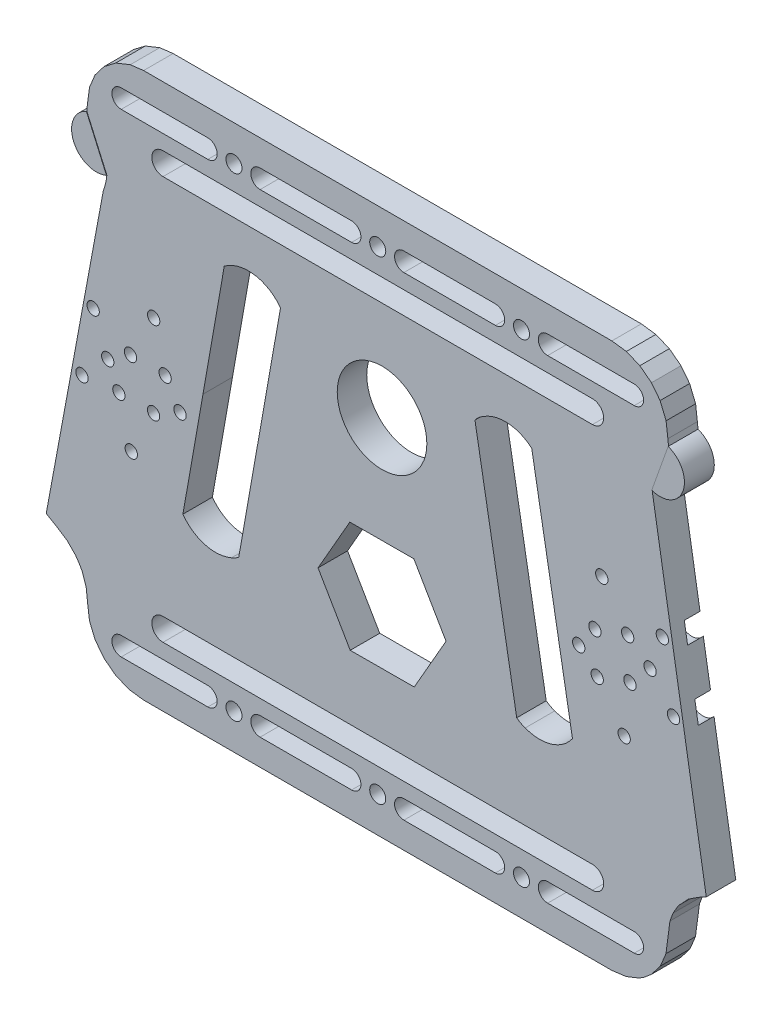
from build123d import *

# Parameters (mm, degrees)
EXTRUDE_1_DEPTH      = 7.9
SKETCH_2_R           = 1.65
CUT_EXTRUDE_1_DEPTH  = 7.9
SKETCH_3_R           = 3.8
CUT_EXTRUDE_2_DEPTH  = 4.2
SKETCH_4_R           = 2.15
CUT_EXTRUDE_4_DEPTH  = 44.2
CUT_EXTRUDE_5_DEPTH  = 44.2
SKETCH_10_R          = 1.65
CUT_EXTRUDE_6_DEPTH  = 44.2
CUT_EXTRUDE_7_DEPTH  = 10
CUT_EXTRUDE_8_DEPTH  = 10
CUT_EXTRUDE_9_DEPTH  = 10
SKETCH_14_R          = 1.65
CUT_EXTRUDE_10_DEPTH = 10
SKETCH_16_R          = 3.8
CUT_EXTRUDE_11_DEPTH = 4.2
CUT_EXTRUDE_12_DEPTH = 10
CUT_EXTRUDE_13_DEPTH = 10
FILLET_1_R           = 10
FILLET_START         = -1
FILLET_2_DEPTH       = 10
FILLET_4_R           = 2
FILLET_5_R           = 10
FILLET_7_R           = 3
CUT_EXTRUDE_15_DEPTH = 10
EXTRUDE_2_DEPTH      = 8
SKETCH_26_R          = 12
CUT_EXTRUDE_17_DEPTH = 162


with BuildPart() as part:
    # 草图1 → 凸台-拉伸1 (new body)
    with BuildSketch(Plane.XY):
        Polygon((-10.305702603, 68.606601718), (-12.692955915, 65.493979681), (-14.189528165, 61.876534179), (-14.699100885, 58), (-14.70067514, 57.601052113), (-14.77881855, 57.412167461), (-15.054381323, 54.573032239), (-16.159009324, 51.363451204), (-17.862653632, 48.604326557), (-20.254556955, 46.165014633), (-20.718749039, 45.625960936), (-20.964899937, 44.958530853), (-23.319564087, 31.429589539), (-22.957868176, 30.282436667), (-22.625738047, 29.915023731), (-22.142232012, 29.606620125), (-21.666860443, 29.459974033), (-19.523247649, 29.081997262), (-17.379634855, 28.70402049), (-16.666577501, 28.484051352), (-16.093471071, 28.144249508), (-15.936735259, 28.017485287), (-15.443123256, 27.47032654), (-15.092973508, 26.806644636), (-14.912685899, 26.018841536), (-14.900579388, 25.749597231), (-14.957245947, 25.165759219), (-26.620853412, -41.025673469), (-26.628464015, -41.199984954), (-26.547792108, -41.762283515), (-26.368057646, -42.1868051), (-26.056996513, -42.599733112), (-22.845462219, -44.475665886), (-20.18788619, -46.219365909), (-17.900579388, -48.555812521), (-16.896667913, -50.001863236), (-16.145337406, -51.392208514), (-15.074507578, -54.48350874), (-14.699100885, -58), (-14.189528165, -61.876534179), (-12.692955915, -65.493979681), (-10.305702603, -68.606601718), (-7.193080565, -70.99385503), (-3.575635064, -72.49042728), (0.300899115, -73), (125.699100885, -73), (129.575635064, -72.49042728), (132.886301512, -71.16602245), (133.848368307, -70.593229947), (134.30843717, -70.283294701), (136.305702603, -68.606601718), (138.692955915, -65.493979681), (140.189528165, -61.876534179), (140.699100885, -58), (141.254605616, -53.774041673), (142.087560808, -51.515511001), (143.523015152, -49.058061077), (146.18788619, -46.219365909), (148.845462219, -44.475665886), (150.900129557, -43.358777059), (151.654650016, -42.916650994), (152.056996513, -42.599733112), (152.350719669, -42.216761952), (152.44744501, -42.031434376), (152.551722788, -41.748688604), (152.623435941, -41.341713631), (152.628464015, -41.199984954), (152.598079521, -40.852688599), (140.946156129, 25.228652698), (140.900579388, 25.749597231), (140.97479102, 26.412743086), (141.213193945, 27.0829987), (141.602446059, 27.67796006), (142.087560808, 28.1397779), (142.663370866, 28.482602001), (143.346454142, 28.69797733), (147.715814351, 29.469236069), (148.142232012, 29.606620125), (148.507788071, 29.820824869), (148.769890787, 30.052435784), (148.957868176, 30.282436667), (149.050507066, 30.427673174), (149.235552102, 30.856013103), (149.316204873, 31.313720762), (149.297310528, 31.727110992), (146.772117825, 45.529310251), (144.408906028, 48.203641159), (143.944943592, 48.499578911), (142.159009324, 51.363451204), (141.067461329, 54.51456119), (140.699100885, 57.818365652), (140.226674821, 61.734915731), (138.61919198, 65.620449206), (136.305702603, 68.606601718), (133.193080565, 70.99385503), (129.575635064, 72.49042728), (125.699100885, 73), (0.300899115, 73), (-3.265894684, 72.569762592), (-7.165299034, 71.009838016), align=None)
    extrude(amount=EXTRUDE_1_DEPTH)

    # 草图2 → 切除-拉伸1 (cut)
    with BuildSketch(Plane.XY):
        with Locations((-13.214266644, 11.088086267)):
            Circle(SKETCH_2_R)
        with Locations((2.995431065, 16.987933739)):
            Circle(SKETCH_2_R)
        with Locations((-16.209697709, -5.899847472)):
            Circle(SKETCH_2_R)
        with Locations((-2.995431065, -16.987933739)):
            Circle(SKETCH_2_R)
        with Locations((123.004568935, 16.987933739)):
            Circle(SKETCH_2_R)
        with Locations((139.214266644, 11.088086267)):
            Circle(SKETCH_2_R)
        with Locations((142.209697709, -5.899847472)):
            Circle(SKETCH_2_R)
        with Locations((128.995431065, -16.987933739)):
            Circle(SKETCH_2_R)
    extrude(amount=CUT_EXTRUDE_1_DEPTH, mode=Mode.SUBTRACT)

    # 草图3 → 切除-拉伸2 (cut)
    with BuildSketch(Plane.XY):
        with Locations((-13.214266644, 11.088086267)):
            Circle(SKETCH_3_R)
        with Locations((2.995431065, 16.987933739)):
            Circle(SKETCH_3_R)
        with Locations((-16.209697709, -5.899847472)):
            Circle(SKETCH_3_R)
        with Locations((-2.995431065, -16.987933739)):
            Circle(SKETCH_3_R)
        with Locations((123.004568935, 16.987933739)):
            Circle(SKETCH_3_R)
        with Locations((139.214266644, 11.088086267)):
            Circle(SKETCH_3_R)
        with Locations((142.209697709, -5.899847472)):
            Circle(SKETCH_3_R)
        with Locations((128.995431065, -16.987933739)):
            Circle(SKETCH_3_R)
    extrude(amount=CUT_EXTRUDE_2_DEPTH, mode=Mode.SUBTRACT)

    # 草图4 → 切除-拉伸4 (cut)
    with BuildSketch(Plane.XY):
        with Locations((24.5, 63.5)):
            Circle(SKETCH_4_R)
        with Locations((63, 63.5)):
            Circle(SKETCH_4_R)
        with Locations((101.5, 63.5)):
            Circle(SKETCH_4_R)
        with Locations((24.5, -63.5)):
            Circle(SKETCH_4_R)
        with Locations((63, -63.5)):
            Circle(SKETCH_4_R)
        with Locations((101.5, -63.5)):
            Circle(SKETCH_4_R)
        with BuildLine():
            Line((-5.699100885, 66), (17.5, 66))
            ThreePointArc((17.5, 66), (20, 63.5), (17.5, 61))
            Line((17.5, 61), (-5.699100885, 61))
            ThreePointArc((-5.699100885, 61), (-8.199100885, 63.5), (-5.699100885, 66))
        make_face()
        with BuildLine():
            Line((31.5, 66), (56, 66))
            ThreePointArc((56, 66), (58.5, 63.5), (56, 61))
            Line((56, 61), (31.5, 61))
            ThreePointArc((31.5, 61), (29, 63.5), (31.5, 66))
        make_face()
        with BuildLine():
            Line((-5.699100885, -61), (17.5, -61))
            ThreePointArc((17.5, -61), (20, -63.5), (17.5, -66))
            Line((17.5, -66), (-5.699100885, -66))
            ThreePointArc((-5.699100885, -66), (-8.199100885, -63.5), (-5.699100885, -61))
        make_face()
        with BuildLine():
            Line((31.5, -61), (56, -61))
            ThreePointArc((56, -61), (58.5, -63.5), (56, -66))
            Line((56, -66), (31.5, -66))
            ThreePointArc((31.5, -66), (29, -63.5), (31.5, -61))
        make_face()
        with BuildLine():
            Line((70, -66), (94.5, -66))
            ThreePointArc((94.5, -66), (97, -63.5), (94.5, -61))
            Line((94.5, -61), (70, -61))
            ThreePointArc((70, -61), (67.5, -63.5), (70, -66))
        make_face()
        with BuildLine():
            Line((108.5, -61), (131.699100885, -61))
            ThreePointArc((131.699100885, -61), (134.199100885, -63.5), (131.699100885, -66))
            Line((131.699100885, -66), (108.5, -66))
            ThreePointArc((108.5, -66), (106, -63.5), (108.5, -61))
        make_face()
        with BuildLine():
            Line((5.5, -51), (120.5, -51))
            ThreePointArc((120.5, -51), (123.5, -54), (120.5, -57))
            Line((120.5, -57), (5.5, -57))
            ThreePointArc((5.5, -57), (2.5, -54), (5.5, -51))
        make_face()
        with BuildLine():
            Line((5.5, 57), (120.5, 57))
            ThreePointArc((120.5, 57), (123.5, 54), (120.5, 51))
            Line((120.5, 51), (5.5, 51))
            ThreePointArc((5.5, 51), (2.5, 54), (5.5, 57))
        make_face()
        with BuildLine():
            Line((70, 66), (94.5, 66))
            ThreePointArc((94.5, 66), (97, 63.5), (94.5, 61))
            Line((94.5, 61), (70, 61))
            ThreePointArc((70, 61), (67.5, 63.5), (70, 66))
        make_face()
        with BuildLine():
            Line((108.5, 61), (131.699100885, 61))
            ThreePointArc((131.699100885, 61), (134.199100885, 63.5), (131.699100885, 66))
            Line((131.699100885, 66), (108.5, 66))
            ThreePointArc((108.5, 66), (106, 63.5), (108.5, 61))
        make_face()
    extrude(amount=CUT_EXTRUDE_4_DEPTH, mode=Mode.SUBTRACT)

    # 草图5 → 切除-拉伸5 (cut)
    with BuildSketch(Plane.XY):
        with BuildLine():
            Line((99.95897033, 37.693501904), (111.099420612, -25.749597231))
            ThreePointArc((111.099420612, -25.749597231), (105.951227077, -28.702394871), (100.222961283, -27.150015547))
            Line((100.222961283, -27.150015547), (92.395572602, 17.241186617))
            Line((92.395572602, 17.241186617), (89.033748577, 36.306984423))
            ThreePointArc((89.033748577, 36.306984423), (94.209202281, 39.262930674), (99.95897033, 37.693501904))
        make_face()
        with BuildLine():
            Line((26.04102967, 37.693501904), (14.900579388, -25.749597231))
            ThreePointArc((14.900579388, -25.749597231), (20.052100679, -28.697193196), (25.779041413, -27.138782652))
            Line((25.779041413, -27.138782652), (33.604427398, 17.241186617))
            Line((33.604427398, 17.241186617), (36.96624196, 36.306984423))
            ThreePointArc((36.96624196, 36.306984423), (31.790792987, 39.262928715), (26.04102967, 37.693501904))
        make_face()
    extrude(amount=CUT_EXTRUDE_5_DEPTH, mode=Mode.SUBTRACT)

    # 草图10 → 切除-拉伸6 (cut)
    with BuildSketch(Plane.XY.offset(7.9)):
        with Locations((-6.317784188, -4.999790859)):
            Circle(SKETCH_10_R)
        with Locations((2.971169873, -5.134977431)):
            Circle(SKETCH_10_R)
        with Locations((-3.210982995, 5.315366562)):
            Circle(SKETCH_10_R)
        with Locations((6.0633334, 5.159308491)):
            Circle(SKETCH_10_R)
        with Locations((121.773254005, -6.859076029)):
            Circle(SKETCH_10_R)
        with Locations((130.548252121, -3.809100454)):
            Circle(SKETCH_10_R)
        with Locations((121.164700541, 3.896589871)):
            Circle(SKETCH_10_R)
        with Locations((129.933082223, 6.921946276)):
            Circle(SKETCH_10_R)
    extrude(amount=-CUT_EXTRUDE_6_DEPTH, mode=Mode.SUBTRACT)

    # 草图11 → 切除-拉伸7 (cut)
    with BuildSketch(Plane(origin=(0, 0, 0), x_dir=(-1, 0, 0), z_dir=(0, 0, -1))):
        Polygon((-16.209697709, 5.899847472), (-13.214266644, -11.088086267), (-10.828105678, -24.62067757), (-14.971068735, -25.34817157), (-26.04102967, 37.693501904), (-21.898066613, 38.420995904), align=None)
    extrude(amount=-CUT_EXTRUDE_7_DEPTH, mode=Mode.SUBTRACT)

    # 草图12 → 切除-拉伸8 (cut)
    with BuildSketch(Plane(origin=(0, 0, 0), x_dir=(-1, 0, 0), z_dir=(0, 0, -1))):
        with BuildLine():
            Line((-25.779041413, -27.138782652), (-10.828105678, -24.62067757))
            ThreePointArc((-10.828105678, -24.62067757), (-17.782056907, -28.976170287), (-25.779041413, -27.138782652))
        make_face()
    extrude(amount=-CUT_EXTRUDE_8_DEPTH, mode=Mode.SUBTRACT)

    # 草图13 → 切除-拉伸9 (cut)
    with BuildSketch(Plane(origin=(0, 0, 0), x_dir=(-1, 0, 0), z_dir=(0, 0, -1))):
        with BuildLine():
            Line((-36.96624196, 36.306984423), (-28.974929156, 35.896086524))
            Line((-28.974929156, 35.896086524), (-21.898066613, 38.420995904))
            ThreePointArc((-21.898066613, 38.420995904), (-29.8699804, 40.484711458), (-36.96624196, 36.306984423))
        make_face()
    extrude(amount=-CUT_EXTRUDE_9_DEPTH, mode=Mode.SUBTRACT)

    # 草图14 → 切除-拉伸10 (cut)
    with BuildSketch(Plane(origin=(0, 0, 0), x_dir=(-1, 0, 0), z_dir=(0, 0, -1))):
        with Locations((-135.924131181, 2.119648316)):
            Circle(SKETCH_14_R)
        with Locations((-116.825832972, -1.988783195)):
            Circle(SKETCH_14_R)
        with Locations((-10.050595259, -1.402434888)):
            Circle(SKETCH_14_R)
        with Locations((9.301100971, 1.268905029)):
            Circle(SKETCH_14_R)
    extrude(amount=-CUT_EXTRUDE_10_DEPTH, mode=Mode.SUBTRACT)

    # 草图16 → 切除-拉伸11 (cut)
    with BuildSketch(Plane(origin=(0, 0, 0), x_dir=(-1, 0, 0), z_dir=(0, 0, -1))):
        with Locations((-10.050595259, -1.402434888)):
            Circle(SKETCH_16_R)
        with Locations((9.301100971, 1.268905029)):
            Circle(SKETCH_16_R)
        with Locations((-135.924131181, 2.119648316)):
            Circle(SKETCH_16_R)
        with Locations((-116.825832972, -1.988783195)):
            Circle(SKETCH_16_R)
    extrude(amount=-CUT_EXTRUDE_11_DEPTH, mode=Mode.SUBTRACT)

    # 草图19 → 切除-拉伸12 (cut)
    with BuildSketch(Plane(origin=(0, 0, 0), x_dir=(-1, 0, 0), z_dir=(0, 0, -1))):
        with BuildLine():
            Line((-115.153671104, -24.517328565), (-104.239534494, 37.379815966))
            ThreePointArc((-104.239534494, 37.379815966), (-96.414450848, 39.992621571), (-89.033748577, 36.306984423))
            Line((-89.033748577, 36.306984423), (-100.222961283, -27.150015547))
            ThreePointArc((-100.222961283, -27.150015547), (-108.23356352, -28.925923308), (-115.153671104, -24.517328565))
        make_face()
    extrude(amount=-CUT_EXTRUDE_12_DEPTH, mode=Mode.SUBTRACT)

    # 草图21 → 切除-拉伸13 (cut)
    with BuildSketch(Plane(origin=(0, 0, 0), x_dir=(-1, 0, 0), z_dir=(0, 0, -1))):
        Polygon((-146.772117825, 45.529310251), (-136.474652846, 43.814333368), (-152.089030449, -49.941161633), (-165.706167888, -46.67255076), (-171.282973385, -2.85479329), (-169.291257136, 53.311604922), align=None)
        Polygon((20.964899937, 44.958530853), (10.314171456, 43.814333368), (9.539410351, 43.814333368), (10.543371006, 39.469394477), (28.555174708, -57.759288962), (35.414771485, -56.488535248), (38.378386576, 38.899500191), align=None)
    extrude(amount=-CUT_EXTRUDE_13_DEPTH, mode=Mode.SUBTRACT)

    # 圆角1
    # the kernel refuses this fillet: 10 mm, written as the material it takes off along each edge
    with BuildSketch(Plane(origin=(146.772117825, 45.529310251, -22.647011677), x_dir=(-0.9864136024690109, -0.1642808718752981, 0), z_dir=(0, 0, 1))) as fillet_1_piece_1:
        with BuildLine():
            CenterArc((9.058804671, -10), FILLET_1_R, 90, 45.783037724)
            Line((1.891762849, -3.026226881), (0, 0))
            Line((0, 0), (9.058804671, 0))
        make_face()
    extrude(amount=53.194023354, mode=Mode.SUBTRACT)

    # 圆角2: read off the stored shape, not the designer's step
    # 圆角2 outline → 圆角2 (cut)
    with BuildSketch(Plane.XY.offset(FILLET_START)):
        with BuildLine():
            ThreePointArc((143.944943592, 48.499578911), (143.235107621, 47.001088149), (142.074248426, 45.817133928))
            ThreePointArc((142.074248426, 45.817133928), (143.341874852, 46.912269), (144.408906028, 48.203641159))
            Line((144.408906028, 48.203641159), (143.944943592, 48.499578911))
        make_face()
    extrude(amount=FILLET_2_DEPTH, mode=Mode.SUBTRACT)

    # 圆角4
    fillet_4_edges = [part.edges().sort_by_distance(p)[0] for p in [
        (143.944943592, 48.499578911, 3.95),
    ]]
    fillet(fillet_4_edges, radius=FILLET_4_R)

    # 圆角5
    # the kernel refuses this fillet: 10 mm, written as the material it takes off along each edge
    with BuildSketch(Plane(origin=(-20.964899937, 44.958530853, -9.558497085), x_dir=(0.3460217076370238, 0.9382265066837314, 0), z_dir=(0, 0, 1))) as fillet_5_piece_1:
        with BuildLine():
            CenterArc((10.630433958, -1.269745053), FILLET_5_R, 172.705204694, 21.407258603)
            Line((0.93224396, -3.708004833), (0.73828016, -3.756770029))
            Line((0.73828016, -3.756770029), (-0.1939638, -0.048765196))
            Line((-0.1939638, -0.048765196), (0, 0.2))
            ThreePointArc((0, 0.2), (0.355687075, 0.2), (0.512992953, 0.025394901))
            Line((0.512992953, 0.025394901), (0.711374149, 0))
        make_face()
    extrude(amount=27.016994169, mode=Mode.SUBTRACT)

    # 圆角7
    # the kernel refuses this fillet: 3 mm, written as the material it takes off along each edge
    with BuildSketch(Plane(origin=(-20.718749039, 45.625960936, -6.365273371), x_dir=(0.9383419114779138, -0.3457086304447355, 0), z_dir=(0, 0, 1))) as fillet_7_piece_1:
        with BuildLine():
            CenterArc((2.164192946, 2.975590674), FILLET_7_R, 230.332904074, 46.981009108)
            Line((0.249215372, 0.666291887), (0, 0))
            ThreePointArc((0, 0), (1.273054674, -0.081364419), (2.546109348, 0))
        make_face()
    extrude(amount=20.630546742, mode=Mode.SUBTRACT)

    # 草图24 → 切除-拉伸15 (cut)
    with BuildSketch(Plane(origin=(0, 0, 0), x_dir=(-1, 0, 0), z_dir=(0, 0, -1))):
        with BuildLine():
            Line((-136.474652846, 43.814333368), (-140.883281107, 56.166463421))
            ThreePointArc((-140.883281107, 56.166463421), (-144.855032003, 47.786084264), (-136.474652846, 43.814333368))
        make_face()
        with BuildLine():
            Line((14.916599937, 55.99259985), (9.539410351, 43.814333368))
            ThreePointArc((9.539410351, 43.814333368), (36.124238709, 39.352327951), (14.916599937, 55.99259985))
        make_face()
    extrude(amount=-CUT_EXTRUDE_15_DEPTH, mode=Mode.SUBTRACT)

    # 草图25 → 凸台-拉伸2 (add)
    with BuildSketch(Plane(origin=(0, 0, 0), x_dir=(-1, 0, 0), z_dir=(0, 0, -1))):
        with BuildLine():
            Line((-140.883281107, 56.166463421), (-136.474652846, 43.814333368))
            ThreePointArc((-136.474652846, 43.814333368), (-144.855032003, 47.786084264), (-140.883281107, 56.166463421))
        make_face()
        with BuildLine():
            Line((14.916599937, 55.99259985), (9.539410351, 43.814333368))
            ThreePointArc((9.539410351, 43.814333368), (18.317138385, 47.214871816), (14.916599937, 55.99259985))
        make_face()
    extrude(amount=-EXTRUDE_2_DEPTH)

    # 草图26 → 切除-拉伸17 (cut)
    with BuildSketch(Plane(origin=(0, 0, 0), x_dir=(-1, 0, 0), z_dir=(0, 0, -1))):
        with Locations((-64.153920955, 24.379718098)):
            Circle(SKETCH_26_R)
        Polygon((-81.293611376, -18.865156351), (-72.77239177, -33.736637674), (-55.632701349, -33.792785685), (-47.014230534, -18.977452373), (-55.535450141, -4.10597105), (-72.675140562, -4.049823039), align=None)
    extrude(amount=-CUT_EXTRUDE_17_DEPTH, mode=Mode.SUBTRACT)


solid = part.part
